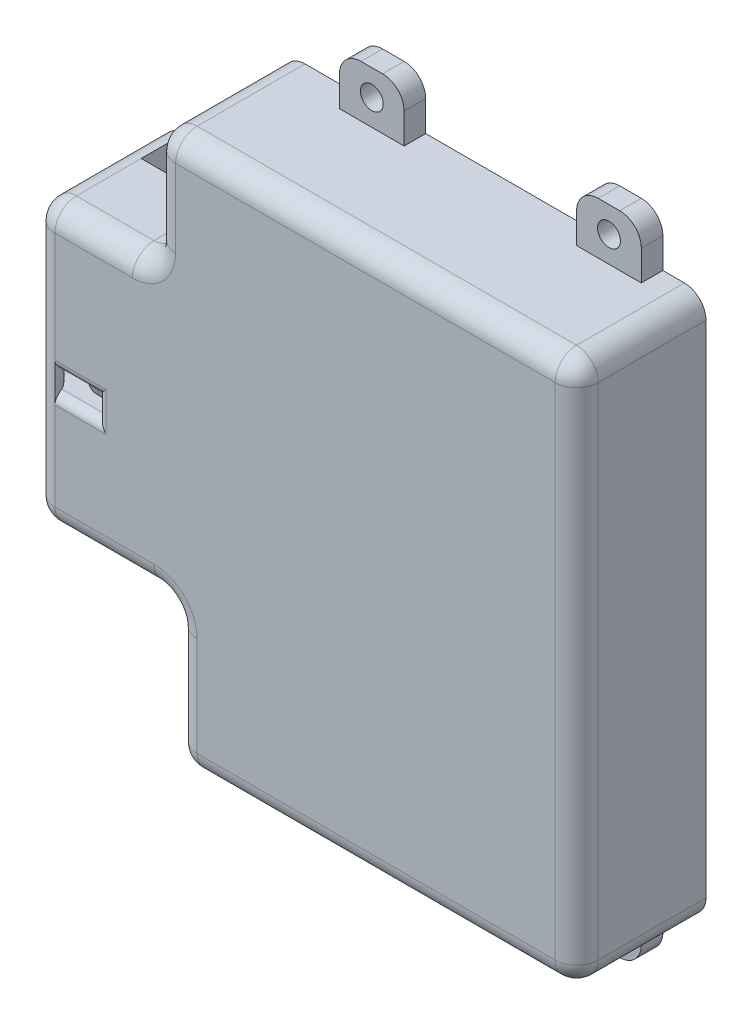
from build123d import *

# Parameters (mm, degrees)
ESQUISSE1_W             = 126
ESQUISSE1_H             = 126
ESQUISSE1_W_2           = 116
ESQUISSE1_H_2           = 116
BOSS_EXTRU_1_DEPTH      = 25
ESQUISSE2_W             = 126
ESQUISSE2_H             = 126
BOSS_EXTRU_2_DEPTH      = 5
ENL_V_START             = -30
ESQUISSE3_W             = 28
ESQUISSE3_H             = 28
ESQUISSE3_W_2           = 33
ESQUISSE3_H_2           = 33
ENL_V_MAT_EXTRU_1_DEPTH = 30
BOSS_EXTRU_3_DEPTH      = 15
ESQUISSE5_W             = 15
ESQUISSE5_H             = 12
BOSS_EXTRU_4_DEPTH      = 5
CONG_1_R                = 5
D_GAGEMENT_M51_D        = 5.3
ESQUISSE9_W             = 10
ESQUISSE9_H             = 5
CONG_2_R                = 2


# Some blends are built 0.0001 mm under size
with BuildPart() as part:
    # Esquisse1 → Boss.-Extru.1 (new body)
    with BuildSketch(Plane.XY):
        Rectangle(ESQUISSE1_W, ESQUISSE1_H)
        Rectangle(ESQUISSE1_W_2, ESQUISSE1_H_2, mode=Mode.SUBTRACT)
    extrude(amount=BOSS_EXTRU_1_DEPTH)

    # Esquisse2 → Boss.-Extru.2 (add)
    with BuildSketch(Plane.XY.offset(25)):
        Rectangle(ESQUISSE2_W, ESQUISSE2_H)
    extrude(amount=BOSS_EXTRU_2_DEPTH)

    # Esquisse3 → Enlèv. mat.-Extru.1 (cut)
    with BuildSketch(Plane.XY.offset(30).offset(ENL_V_START)):
        with Locations((-49, 49)):
            Rectangle(ESQUISSE3_W, ESQUISSE3_H)
        with Locations((-46.5, -46.5)):
            Rectangle(ESQUISSE3_W_2, ESQUISSE3_H_2)
    extrude(amount=ENL_V_MAT_EXTRU_1_DEPTH, mode=Mode.SUBTRACT)

    # Esquisse4 → Boss.-Extru.3 (add)
    with BuildSketch(Plane(origin=(0, 0, 25), x_dir=(-1, 0, 0), z_dir=(0, 0, -1))):
        Polygon((35, 58), (35, 35), (58, 35), (58, 30), (30, 30), (30, 58), align=None)
        Polygon((58, -25), (25, -25), (25, -58), (30, -58), (30, -30), (58, -30), align=None)
    extrude(amount=BOSS_EXTRU_3_DEPTH)

    # Esquisse5 → Boss.-Extru.4 (add)
    with BuildSketch(Plane.XY):
        with Locations((-9.5, 69)):
            Rectangle(ESQUISSE5_W, ESQUISSE5_H)
        with Locations((45.5, 69)):
            Rectangle(ESQUISSE5_W, ESQUISSE5_H)
        with Locations((45.5, -69)):
            Rectangle(ESQUISSE5_W, ESQUISSE5_H)
        with Locations((-9.5, -69)):
            Rectangle(ESQUISSE5_W, ESQUISSE5_H)
    extrude(amount=BOSS_EXTRU_4_DEPTH)

    # Congé1
    cong_1_edges = [part.edges().sort_by_distance(p)[0] for p in [
        (-25, -41.5, 25),
        (16.5, -58, 25),
        (58, 0, 25),
        (14, 58, 25),
        (-30, 44, 25),
        (-44, 30, 25),
        (-58, 2.5, 25),
        (-41.5, -25, 25),
        (-63, 2.5, 30),
        (-49, 35, 30),
        (-35, 49, 30),
        (14, 63, 30),
        (63, 0, 30),
        (16.5, -63, 30),
        (-30, -46.5, 30),
        (-46.5, -30, 30),
        (58, -58, 12.5),
        (-25, -58, 17.5),
        (-25, -25, 17.5),
        (-58, -25, 17.5),
        (-58, 30, 17.5),
        (-30, 30, 17.5),
        (-30, 58, 17.5),
        (58, 58, 12.5),
        (53, -75, 2.5),
        (-2, -75, 2.5),
        (38, -75, 2.5),
        (-17, -75, 2.5),
        (-30, -63, 15),
        (-63, 35, 15),
        (-63, -30, 15),
        (-30, -30, 20),
        (-35, 35, 20),
        (53, 75, 2.5),
        (38, 75, 2.5),
        (-2, 75, 2.5),
        (-17, 75, 2.5),
        (63, 63, 15),
        (63, -63, 15),
        (-35, 63, 15),
    ]]
    fillet(cong_1_edges, radius=CONG_1_R - 0.0001)  # a hair under: the kernel refuses the full size

    # Dégagement M51 (through all)
    with Locations(Plane(origin=(0, 0, 0), x_dir=(1, 0, 0), z_dir=(0, 0, -1))):
        with Locations((-9.5, 69), (45.5, 69), (45.5, -69), (-9.5, -69)):
            Hole(D_GAGEMENT_M51_D / 2)

    # Esquisse9 → Enlèvement de matière-Révolution1 (revolve, cut)
    with BuildSketch(Plane.XY.offset(30)):
        with Locations((-53, 0)):
            Rectangle(ESQUISSE9_W, ESQUISSE9_H)
    revolve(axis=Axis((-63, 30, 30), (0, -1, 0)), mode=Mode.SUBTRACT)

    # Congé2
    # the kernel refuses this fillet: 2 mm, written as the material it takes off along each edge
    with BuildSketch(Plane(origin=(-48, -2.5, 30), x_dir=(1, 0, 0), z_dir=(0, 1, 0))) as cong_2_piece_1:
        with BuildLine():
            CenterArc((1.881943016, 2), CONG_2_R, 186.756327031, 83.243672969)
            ThreePointArc((-0.104167927, 1.764705882), (-0.026064627, 0.883888823), (0, 0))
            Line((0, 0), (1.881943016, 0))
        make_face()
    extrude(amount=5, mode=Mode.SUBTRACT)
    with BuildSketch(Plane(origin=(-43, 2.5, 30), x_dir=(0, 1, 0), z_dir=(-1, 0, 0))) as cong_2_piece_2_section:
        with BuildLine():
            CenterArc((CONG_2_R, CONG_2_R), CONG_2_R, 180, 90)
            Line((0, CONG_2_R), (0, 0))
            Line((0, 0), (CONG_2_R, 0))
        make_face()
    cong_2_piece_2 = extrude(amount=20, mode=Mode.PRIVATE)
    cong_2_piece_2 = cong_2_piece_2 & Plane(origin=(-63, 2.951907802, 30), x_dir=(1, 0, 0), z_dir=(0, 1, 0)) * Cylinder(15, 48, mode=Mode.PRIVATE)
    cong_2_piece_2 = cong_2_piece_2 - Plane(origin=(-63, 2.951907802, 30), x_dir=(1, 0, 0), z_dir=(0, -1, 0)) * Cylinder(5, 48, mode=Mode.PRIVATE)
    add(cong_2_piece_2, mode=Mode.SUBTRACT)
    with BuildSketch(Plane(origin=(-63, -2.5, 30), x_dir=(0, -1, 0), z_dir=(1, 0, 0))) as cong_2_piece_3_section:
        with BuildLine():
            CenterArc((CONG_2_R, CONG_2_R), CONG_2_R, 180, 90)
            Line((0, CONG_2_R), (0, 0))
            Line((0, 0), (CONG_2_R, 0))
        make_face()
    cong_2_piece_3 = extrude(amount=20, mode=Mode.PRIVATE)
    cong_2_piece_3 = cong_2_piece_3 & Plane(origin=(-63, -2.951907802, 30), x_dir=(1, 0, 0), z_dir=(0, 1, 0)) * Cylinder(15, 48, mode=Mode.PRIVATE)
    cong_2_piece_3 = cong_2_piece_3 - Plane(origin=(-63, -2.951907802, 30), x_dir=(1, 0, 0), z_dir=(0, -1, 0)) * Cylinder(5, 48, mode=Mode.PRIVATE)
    add(cong_2_piece_3, mode=Mode.SUBTRACT)
    with BuildSketch(Plane(origin=(-63, 2.5, 30), x_dir=(1, 0, 0), z_dir=(0, 0, -1))) as cong_2_piece_4_section:
        with BuildLine():
            CenterArc((CONG_2_R, -CONG_2_R), CONG_2_R, 90, 90)
            Line((0, -CONG_2_R), (0, 0))
            Line((0, 0), (CONG_2_R, 0))
        make_face()
    cong_2_piece_4 = extrude(amount=20, mode=Mode.PRIVATE)
    cong_2_piece_4 = cong_2_piece_4 & Plane(origin=(-63, 2.951908225, 30), x_dir=(1, 0, 0), z_dir=(0, 1, 0)) * Cylinder(15, 49, mode=Mode.PRIVATE)
    cong_2_piece_4 = cong_2_piece_4 - Plane(origin=(-63, 2.951908225, 30), x_dir=(1, 0, 0), z_dir=(0, -1, 0)) * Cylinder(5, 49, mode=Mode.PRIVATE)
    add(cong_2_piece_4, mode=Mode.SUBTRACT)
    with BuildSketch(Plane(origin=(-63, -2.5, 15), x_dir=(0, 0, -1), z_dir=(0, 1, 0))) as cong_2_piece_5:
        with BuildLine():
            CenterArc((1.881943016, -2), CONG_2_R, 90, 83.243672969)
            ThreePointArc((-0.104167927, -1.764705882), (-0.026064627, -0.883888823), (0, 0))
            Line((0, 0), (1.881943016, 0))
        make_face()
    extrude(amount=5, mode=Mode.SUBTRACT)
    with BuildSketch(Plane(origin=(-63, -2.5, 10), x_dir=(1, 0, 0), z_dir=(0, 0, 1))) as cong_2_piece_6_section:
        with BuildLine():
            CenterArc((CONG_2_R, -CONG_2_R), CONG_2_R, 90, 90)
            Line((0, -CONG_2_R), (0, 0))
            Line((0, 0), (CONG_2_R, 0))
        make_face()
    cong_2_piece_6 = extrude(amount=20, mode=Mode.PRIVATE)
    cong_2_piece_6 = cong_2_piece_6 - Plane(origin=(-63, -2.951908225, 30), x_dir=(1, 0, 0), z_dir=(0, -1, 0)) * Cylinder(5, 48, mode=Mode.PRIVATE)
    cong_2_piece_6 = cong_2_piece_6 & Plane(origin=(-63, -2.951908225, 30), x_dir=(1, 0, 0), z_dir=(0, 1, 0)) * Cylinder(15, 48, mode=Mode.PRIVATE)
    add(cong_2_piece_6, mode=Mode.SUBTRACT)
    with BuildSketch(Plane(origin=(-48, -7.20485754, 30), x_dir=(1, 0, 0), z_dir=(0, 1, 0))) as cong_2_piece_7a_section:
        with BuildLine():
            CenterArc((1.881943016, 2), CONG_2_R, 186.756327031, 83.243672969)
            ThreePointArc((-0.104167927, 1.764705882), (-0.026064627, 0.883888823), (0, 0))
            Line((0, 0), (1.881943016, 0))
        make_face()
    cong_2_piece_7a = extrude(amount=9.70485754, mode=Mode.PRIVATE)
    cong_2_piece_7a = split(cong_2_piece_7a, bisect_by=Plane(origin=(-47.580339744, -2.5, 29.603813963), z_dir=(0, -1, 0)), keep=Keep.TOP, mode=Mode.PRIVATE)
    with BuildSketch(Plane(origin=(-63, -2.5, 30), x_dir=(0, -1, 0), z_dir=(1, 0, 0))) as cong_2_piece_7b_section:
        with BuildLine():
            CenterArc((CONG_2_R, CONG_2_R), CONG_2_R, 180, 90)
            Line((0, CONG_2_R), (0, 0))
            Line((0, 0), (CONG_2_R, 0))
        make_face()
    cong_2_piece_7b = extrude(amount=20, mode=Mode.PRIVATE)
    cong_2_piece_7b = cong_2_piece_7b - Plane(origin=(-63, -2.951929409, 30), x_dir=(1, 0, 0), z_dir=(0, 1, 0)) * Cylinder(15, 48, mode=Mode.PRIVATE)
    cong_2_piece_7 = cong_2_piece_7a & cong_2_piece_7b
    add(cong_2_piece_7, mode=Mode.SUBTRACT)
    with BuildSketch(Plane(origin=(-43, 2.5, 30), x_dir=(0, 1, 0), z_dir=(-1, 0, 0))) as cong_2_piece_8a_section:
        with BuildLine():
            CenterArc((CONG_2_R, CONG_2_R), CONG_2_R, 180, 90)
            Line((0, CONG_2_R), (0, 0))
            Line((0, 0), (CONG_2_R, 0))
        make_face()
    cong_2_piece_8a = extrude(amount=20, mode=Mode.PRIVATE)
    cong_2_piece_8a = cong_2_piece_8a - Plane(origin=(-63, 2.951929409, 30), x_dir=(1, 0, 0), z_dir=(0, 1, 0)) * Cylinder(15, 48, mode=Mode.PRIVATE)
    with BuildSketch(Plane(origin=(-48, -2.5, 30), x_dir=(1, 0, 0), z_dir=(0, 1, 0))) as cong_2_piece_8b_section:
        with BuildLine():
            CenterArc((1.881943016, 2), CONG_2_R, 186.756327031, 83.243672969)
            ThreePointArc((-0.104167927, 1.764705882), (-0.026064627, 0.883888823), (0, 0))
            Line((0, 0), (1.881943016, 0))
        make_face()
    cong_2_piece_8b = extrude(amount=9.70485754, mode=Mode.PRIVATE)
    cong_2_piece_8b = split(cong_2_piece_8b, bisect_by=Plane(origin=(-47.580339744, 2.5, 29.603813963), z_dir=(0, 1, 0)), keep=Keep.TOP, mode=Mode.PRIVATE)
    cong_2_piece_8 = cong_2_piece_8a & cong_2_piece_8b
    add(cong_2_piece_8, mode=Mode.SUBTRACT)
    with BuildSketch(Plane(origin=(-63, 2.5, 30), x_dir=(1, 0, 0), z_dir=(0, 0, -1))) as cong_2_piece_9a_section:
        with BuildLine():
            CenterArc((CONG_2_R, -CONG_2_R), CONG_2_R, 90, 90)
            Line((0, -CONG_2_R), (0, 0))
            Line((0, 0), (CONG_2_R, 0))
        make_face()
    cong_2_piece_9a = extrude(amount=20, mode=Mode.PRIVATE)
    cong_2_piece_9a = cong_2_piece_9a - Plane(origin=(-63, 2.951929806, 30), x_dir=(1, 0, 0), z_dir=(0, 1, 0)) * Cylinder(15, 49, mode=Mode.PRIVATE)
    with BuildSketch(Plane(origin=(-63, -2.5, 15), x_dir=(0, 0, -1), z_dir=(0, 1, 0))) as cong_2_piece_9b_section:
        with BuildLine():
            CenterArc((1.881943016, -2), CONG_2_R, 90, 83.243672969)
            ThreePointArc((-0.104167927, -1.764705882), (-0.026064627, -0.883888823), (0, 0))
            Line((0, 0), (1.881943016, 0))
        make_face()
    cong_2_piece_9b = extrude(amount=9.70485754, mode=Mode.PRIVATE)
    cong_2_piece_9b = split(cong_2_piece_9b, bisect_by=Plane(origin=(-62.603813963, 2.5, 14.580339744), z_dir=(0, 1, 0)), keep=Keep.TOP, mode=Mode.PRIVATE)
    cong_2_piece_9 = cong_2_piece_9a & cong_2_piece_9b
    add(cong_2_piece_9, mode=Mode.SUBTRACT)
    with BuildSketch(Plane(origin=(-63, -2.5, 10), x_dir=(1, 0, 0), z_dir=(0, 0, 1))) as cong_2_piece_10a_section:
        with BuildLine():
            CenterArc((CONG_2_R, -CONG_2_R), CONG_2_R, 90, 90)
            Line((0, -CONG_2_R), (0, 0))
            Line((0, 0), (CONG_2_R, 0))
        make_face()
    cong_2_piece_10a = extrude(amount=20, mode=Mode.PRIVATE)
    cong_2_piece_10a = cong_2_piece_10a - Plane(origin=(-63, -2.951929806, 30), x_dir=(1, 0, 0), z_dir=(0, 1, 0)) * Cylinder(15, 48, mode=Mode.PRIVATE)
    with BuildSketch(Plane(origin=(-63, -7.20485754, 15), x_dir=(0, 0, -1), z_dir=(0, 1, 0))) as cong_2_piece_10b_section:
        with BuildLine():
            CenterArc((1.881943016, -2), CONG_2_R, 90, 83.243672969)
            ThreePointArc((-0.104167927, -1.764705882), (-0.026064627, -0.883888823), (0, 0))
            Line((0, 0), (1.881943016, 0))
        make_face()
    cong_2_piece_10b = extrude(amount=9.70485754, mode=Mode.PRIVATE)
    cong_2_piece_10b = split(cong_2_piece_10b, bisect_by=Plane(origin=(-62.603813963, -2.5, 14.580339744), z_dir=(0, -1, 0)), keep=Keep.TOP, mode=Mode.PRIVATE)
    cong_2_piece_10 = cong_2_piece_10a & cong_2_piece_10b
    add(cong_2_piece_10, mode=Mode.SUBTRACT)


solid = part.part
